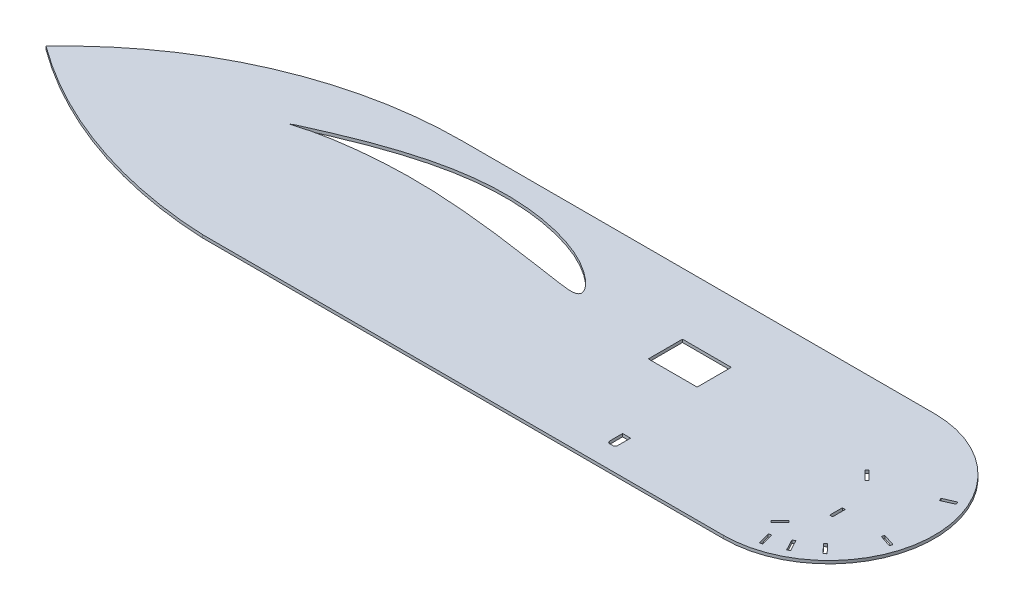
from build123d import *

# Parameters (mm, degrees)
BOSS_EXTRUDE1_DEPTH = 3
SKETCH2_W           = 50
SKETCH2_H           = 35
SKETCH2_W_2         = 3
SKETCH2_H_2         = 13
CUT_EXTRUDE1_DEPTH  = 934.342916617


with BuildPart() as part:
    # Sketch1 → Boss-Extrude1 (new body)
    with BuildSketch(Plane(origin=(0, 0, 0), x_dir=(1, 0, 0), z_dir=(0, 1, 0))):
        with BuildLine():
            Line((266.408252791, 0), (800, 0))
            ThreePointArc((800, 0), (908, 108), (800, 216))
            Line((800, 216), (316.294556964, 216))
            ThreePointArc((316.294556964, 216), (154.432198565, 182.326352039), (19.429068043, 86.893169221))
            ThreePointArc((19.429068043, 86.893169221), (136.475600537, 25.133273094), (266.408252791, 0))
        make_face()
    extrude(amount=BOSS_EXTRUDE1_DEPTH)

    # Sketch2 → Cut-Extrude1 (cut, through all)
    with BuildSketch(Plane.XZ):
        with Locations((630.07, -135.5)):
            Rectangle(SKETCH2_W, SKETCH2_H)
        Polygon((823.689305431, -121.232773416), (814.496917276, -130.425161571), (816.618237619, -132.546481915), (825.810625775, -123.354093759), align=None)
        Polygon((824.491382454, -25.036935183), (827.955301927, -12.506920743), (825.063760133, -11.70755471), (821.59984066, -24.237569151), align=None)
        with Locations((837.956551938, -78.816857662)):
            Rectangle(SKETCH2_W_2, SKETCH2_H_2)
        with BuildLine():
            Line((212.57, -142.261782597), (212.57, -142.294782597))
            add(Edge.make_bspline(
                [(212.57, -142.294782597), (212.815137814, -142.460102486), (213.721483955, -143.071338431), (215.664179604, -144.220627165), (218.723437449, -145.777902142), (222.783765044, -147.580430449), (227.75908382, -149.780753256), (233.673151887, -152.372942719), (243.334631626, -156.473964415), (254.071597155, -160.928560196), (265.811315632, -165.551386352), (275.559769605, -169.192616013), (285.820264156, -172.789650289), (300.213165162, -177.442893994), (315.047470761, -181.61442891), (330.216772764, -185.078244178), (341.716798025, -187.262793988), (353.238408154, -188.970546018), (364.74982071, -190.189827969), (376.222154657, -190.889317525), (387.611451467, -191.086885836), (398.853751386, -190.764655348), (413.421420996, -189.696341642), (427.580802498, -187.700042396), (441.195366572, -184.827458978), (450.821943115, -182.319735681), (459.948918056, -179.469695278), (468.511745548, -176.287644359), (476.453624938, -172.824739179), (483.715148146, -169.128859345), (490.24814377, -165.284833696), (496.019667562, -161.40694583), (500.998027396, -157.585747413), (505.147593549, -153.884087589), (508.447339472, -150.382728864), (510.852240131, -147.180842115), (512.23052565, -144.518995071), (512.672376723, -142.438033672), (512.365957104, -140.693980261), (510.836297954, -139.267947677), (508.300825673, -138.604557497), (504.990749494, -138.396901122), (500.845143819, -138.632879923), (495.886387834, -139.207005807), (490.127383335, -140.033765729), (483.600688534, -141.01415409), (476.345974836, -142.081971784), (468.41886468, -143.270863791), (459.86962452, -144.552957933), (447.40415706, -146.414008038), (434.302787697, -148.29198326), (413.230560269, -151.080307043), (394.916461571, -153.170522792), (372.413070638, -155.185169178), (353.278576878, -156.497400442), (334.10390548, -157.12050793), (318.83753012, -157.119300437), (307.569298967, -156.863067348), (296.54483902, -156.342386113), (285.853643217, -155.59861473), (275.586288909, -154.654588864), (265.829573747, -153.556930461), (256.673464041, -152.312824912), (248.205041684, -150.95854436), (240.510067524, -149.523302558), (233.666056009, -148.064077742), (227.735558734, -146.629571507), (222.771530443, -145.20558608), (218.774640723, -143.912633605), (215.724793866, -142.995242016), (213.753356987, -142.496728121), (212.816237246, -142.310670921), (212.57, -142.261782597)],
                knots=[0, 0, 0, 0, 0.001413477, 0.005226038, 0.010781091, 0.017815608, 0.026460951, 0.036790889, 0.048685593, 0.076639155, 0.092362872, 0.109003461, 0.126386903, 0.144339126, 0.181312719, 0.200023431, 0.218712626, 0.237261299, 0.255692478, 0.274037197, 0.292192583, 0.310132767, 0.327788163, 0.362001934, 0.378421226, 0.394286639, 0.40954344, 0.424114253, 0.43793778, 0.450941833, 0.463044023, 0.474154417, 0.484164575, 0.493023962, 0.500713088, 0.507125739, 0.512129705, 0.514904185, 0.517171427, 0.520261618, 0.5242453, 0.529497961, 0.536092185, 0.54406114, 0.553363127, 0.563904543, 0.575614949, 0.588420092, 0.60222661, 0.616944448, 0.648675826, 0.665501113, 0.718564132, 0.736789145, 0.773513212, 0.810244924, 0.828488569, 0.846493195, 0.864125178, 0.88124851, 0.897725282, 0.913415058, 0.928184346, 0.941897285, 0.954411455, 0.965602702, 0.975349728, 0.983575522, 0.990284579, 0.99543259, 0.998799869, 1, 1, 1, 1], degree=3))
        make_face()
        with BuildLine():
            Line((658.07, -25.47338103), (658.07, -38.67338103))
            Line((658.07, -38.67338103), (666.27, -38.67338103))
            Line((666.27, -38.67338103), (666.27, -25.47338103))
            ThreePointArc((666.27, -25.47338103), (665.537766953, -23.705614077), (663.77, -22.97338103))
            Line((663.77, -22.97338103), (660.57, -22.97338103))
            ThreePointArc((660.57, -22.97338103), (658.802233047, -23.705614077), (658.07, -25.47338103))
        make_face()
        Polygon((878.550743281, -144.228147459), (890.448339955, -149.467154367), (891.657341549, -146.721555135), (879.759744875, -141.482548226), align=None)
        Polygon((882.696999601, -82.624732608), (895.057081487, -78.596286782), (894.127440143, -75.743960193), (881.767358257, -79.772406019), align=None)
        Polygon((860.516688598, -46.190386351), (869.448965973, -36.745047771), (867.269272455, -34.683752992), (858.336995079, -44.129091572), align=None)
        Polygon((841.854575525, -32.297341884), (847.946442475, -20.813041423), (845.296219292, -19.407225973), (839.204352342, -30.891526434), align=None)
        Polygon((822.408918341, -44.734564453), (813.216530186, -35.542176297), (811.095209842, -37.663496641), (820.287597998, -46.855884796), align=None)
    extrude(amount=-CUT_EXTRUDE1_DEPTH, mode=Mode.SUBTRACT)


solid = part.part
